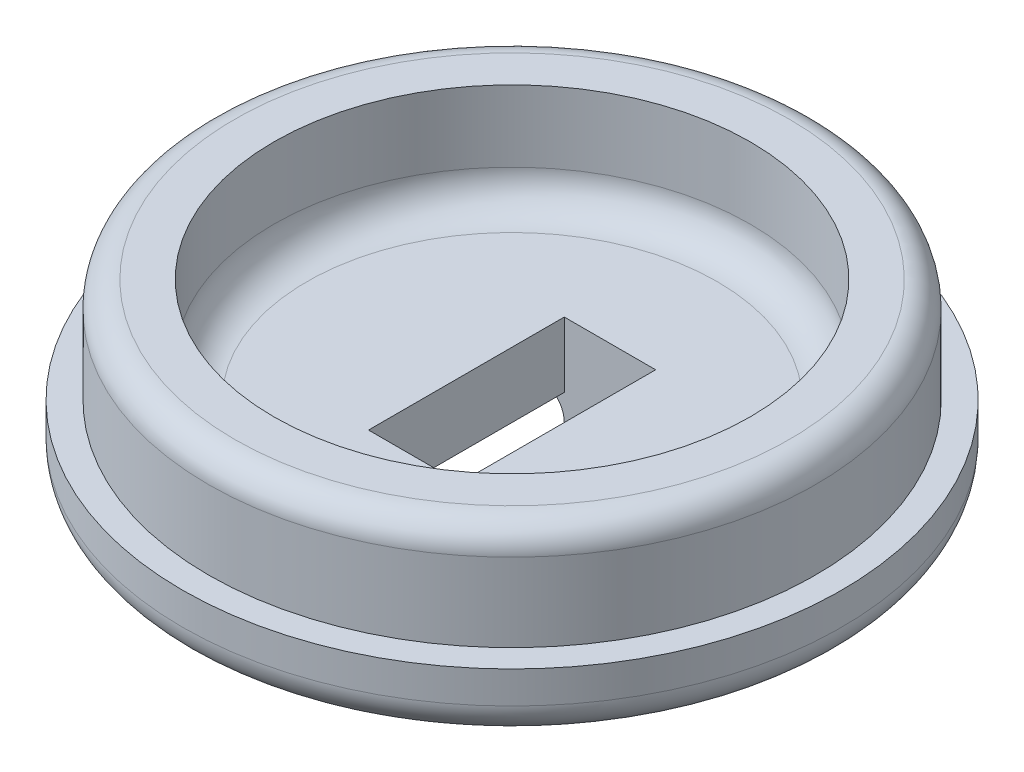
from build123d import *

# Parameters (mm, degrees)
SKETCH1_R           = 25.25
BOSS_EXTRUDE1_DEPTH = 5
SKETCH2_R           = 23.25
SKETCH2_R_2         = 18.25
BOSS_EXTRUDE2_DEPTH = 8
FILLET1_R           = 2.54
FILLET3_R           = 2
SKETCH3_W           = 7
SKETCH3_H           = 15
CUT_EXTRUDE1_DEPTH  = 39.001644834
SKETCH4_W           = 7
SKETCH4_H           = 3
BOSS_EXTRUDE3_DEPTH = 4
SKETCH5_W           = 7
SKETCH5_H           = 21
BOSS_EXTRUDE4_DEPTH = 2
FILLET4_R           = 2
FILLET5_R           = 1
FILLET6_START       = -12.5
FILLET6_DEPTH       = 5
FILLET6_START_2     = 7.5
FILLET6_2_DEPTH     = 5
FILLET6_START_3     = -6
FILLET6_3_DEPTH     = 12


with BuildPart() as part:
    # Sketch1 → Boss-Extrude1 (new body)
    with BuildSketch(Plane(origin=(0, 0, 0), x_dir=(1, 0, 0), z_dir=(0, 1, 0))):
        with Locations(Location((0, 0, 0), (0, 0, 270))):
            Circle(SKETCH1_R)
    extrude(amount=BOSS_EXTRUDE1_DEPTH)

    # Sketch2 → Boss-Extrude2 (add)
    with BuildSketch(Plane(origin=(0, 5, 0), x_dir=(1, 0, 0), z_dir=(0, 1, 0))):
        with Locations(Location((0, 0, 0), (0, 0, 270))):
            Circle(SKETCH2_R)
        with Locations(Location((0, 0, 0), (0, 0, 270))):
            Circle(SKETCH2_R_2, mode=Mode.SUBTRACT)
    extrude(amount=BOSS_EXTRUDE2_DEPTH)

    # Fillet1
    fillet1_edges = [part.edges().sort_by_distance(p)[0] for p in [
        (0, 0, -25.25),
        (0, 5, -18.25),
    ]]
    fillet(fillet1_edges, radius=FILLET1_R)

    # Fillet3
    fillet3_edges = [part.edges().sort_by_distance(p)[0] for p in [
        (0, 13, -23.25),
    ]]
    fillet(fillet3_edges, radius=FILLET3_R)

    # Sketch3 → Cut-Extrude1 (cut, through all)
    with BuildSketch(Plane(origin=(0, 0, 0), x_dir=(-1, 0, 0), z_dir=(0, -1, 0))):
        Rectangle(SKETCH3_W, SKETCH3_H)
    extrude(amount=-CUT_EXTRUDE1_DEPTH, mode=Mode.SUBTRACT)

    # Sketch4 → Boss-Extrude3 (add)
    with BuildSketch(Plane(origin=(0, 0, 0), x_dir=(-1, 0, 0), z_dir=(0, -1, 0))):
        with Locations((0, 9)):
            Rectangle(SKETCH4_W, SKETCH4_H)
        with Locations((0, -9)):
            Rectangle(SKETCH4_W, SKETCH4_H)
    extrude(amount=BOSS_EXTRUDE3_DEPTH)

    # Sketch5 → Boss-Extrude4 (add)
    with BuildSketch(Plane(origin=(0, -4, 0), x_dir=(-1, 0, 0), z_dir=(0, -1, 0))):
        Rectangle(SKETCH5_W, SKETCH5_H)
    extrude(amount=BOSS_EXTRUDE4_DEPTH)

    # Fillet4
    fillet4_edges = [part.edges().sort_by_distance(p)[0] for p in [
        (0, 0, -10.5),
        (0, 0, 10.5),
    ]]
    fillet(fillet4_edges, radius=FILLET4_R)

    # Fillet5
    fillet5_edges = [part.edges().sort_by_distance(p)[0] for p in [
        (0, -4, -7.5),
        (0, -4, 7.5),
    ]]
    fillet(fillet5_edges, radius=FILLET5_R)

    # Fillet6: read off the stored shape, not the designer's step
    # Fillet6 outline → Fillet6 (add)
    with BuildSketch(Plane.XY.offset(FILLET6_START)):
        with BuildLine():
            Line((5.5, 0), (3.5, 0))
            Line((3.5, 0), (3.5, -2))
            ThreePointArc((3.5, -2), (4.085786438, -0.585786438), (5.5, 0))
        make_face()
        with BuildLine():
            ThreePointArc((-5.5, 0), (-4.085786438, -0.585786438), (-3.5, -2))
            Line((-3.5, -2), (-3.5, 0))
            Line((-3.5, 0), (-5.5, 0))
        make_face()
    extrude(amount=FILLET6_DEPTH)

    # Fillet6 2 outline → Fillet6 2 (add)
    with BuildSketch(Plane.XY.offset(FILLET6_START_2)):
        with BuildLine():
            Line((5.5, 0), (3.5, 0))
            Line((3.5, 0), (3.5, -2))
            ThreePointArc((3.5, -2), (4.085786438, -0.585786438), (5.5, 0))
        make_face()
        with BuildLine():
            ThreePointArc((-5.5, 0), (-4.085786438, -0.585786438), (-3.5, -2))
            Line((-3.5, -2), (-3.5, 0))
            Line((-3.5, 0), (-5.5, 0))
        make_face()
    extrude(amount=FILLET6_2_DEPTH)

    # Fillet6 3 outline → Fillet6 3 (cut)
    with BuildSketch(Plane.YZ.offset(FILLET6_START_3)):
        with BuildLine():
            Line((-2, -10.5), (-2, -12.5))
            Line((-2, -12.5), (0, -12.5))
            ThreePointArc((0, -12.5), (-0.585786438, -11.085786438), (-2, -10.5))
        make_face()
        with BuildLine():
            Line((-2, 12.5), (-2, 10.5))
            ThreePointArc((-2, 10.5), (-0.585786438, 11.085786438), (0, 12.5))
            Line((0, 12.5), (-2, 12.5))
        make_face()
    extrude(amount=FILLET6_3_DEPTH, mode=Mode.SUBTRACT)


solid = part.part
